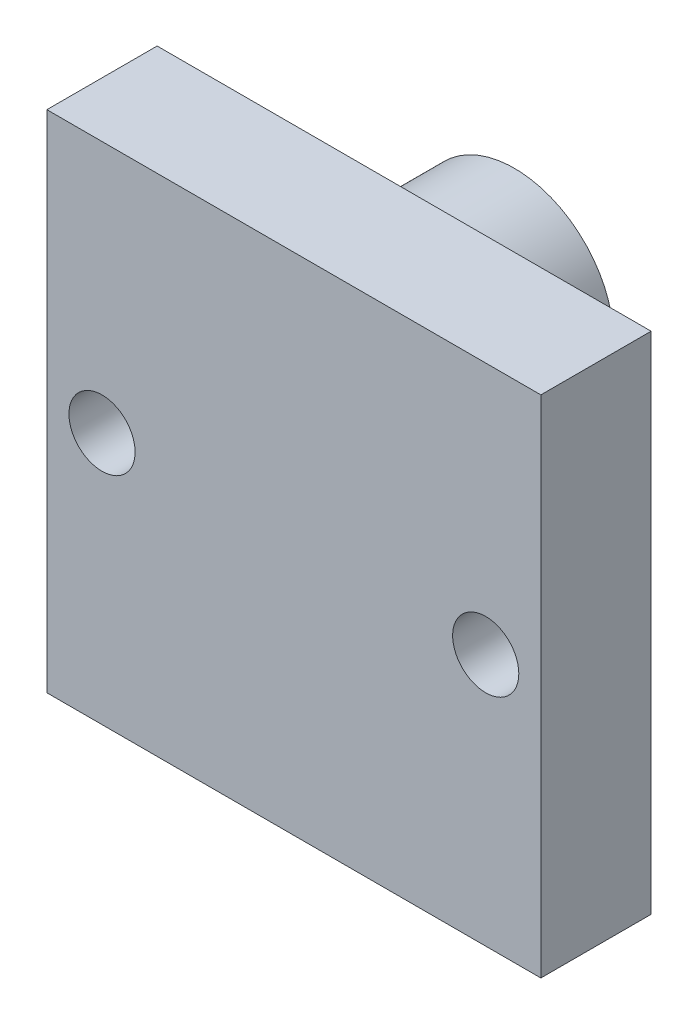
from build123d import *

# Parameters (mm, degrees)
SKETCH1_W           = 22.4
SKETCH1_H           = 22.9
BOSS_EXTRUDE1_DEPTH = 5
SKETCH2_R           = 1.5
CUT_EXTRUDE1_DEPTH  = 5
SKETCH4_R           = 4.5
BOSS_EXTRUDE3_DEPTH = 5


with BuildPart() as part:
    # Sketch1 → Boss-Extrude1 (new body)
    with BuildSketch(Plane.XY):
        Rectangle(SKETCH1_W, SKETCH1_H)
    extrude(amount=BOSS_EXTRUDE1_DEPTH)

    # Sketch2 → Cut-Extrude1 (cut)
    with BuildSketch(Plane.XY.offset(5)):
        with Locations((-8.7, 0)):
            Circle(SKETCH2_R)
        with Locations((8.7, 0)):
            Circle(SKETCH2_R)
    extrude(amount=-CUT_EXTRUDE1_DEPTH, mode=Mode.SUBTRACT)

    # Sketch4 → Boss-Extrude3 (add)
    with BuildSketch(Plane(origin=(0, 0, 0), x_dir=(-1, 0, 0), z_dir=(0, 0, -1))):
        with Locations((0, 5.25)):
            Circle(SKETCH4_R)
    extrude(amount=BOSS_EXTRUDE3_DEPTH)


solid = part.part
